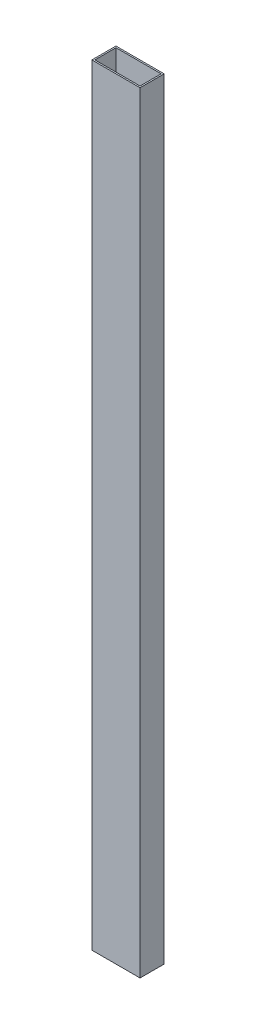
from build123d import *

# Parameters (mm, degrees)
SKETCH1_W           = 50.8
SKETCH1_H           = 25.4
SKETCH1_W_2         = 47.6504
SKETCH1_H_2         = 22.2504
BOSS_EXTRUDE1_DEPTH = 812.8


with BuildPart() as part:
    # Sketch1 → Boss-Extrude1 (new body)
    with BuildSketch(Plane(origin=(0, 0, 0), x_dir=(1, 0, 0), z_dir=(0, 1, 0))):
        Rectangle(SKETCH1_W, SKETCH1_H)
        Rectangle(SKETCH1_W_2, SKETCH1_H_2, mode=Mode.SUBTRACT)
    extrude(amount=BOSS_EXTRUDE1_DEPTH)


solid = part.part
